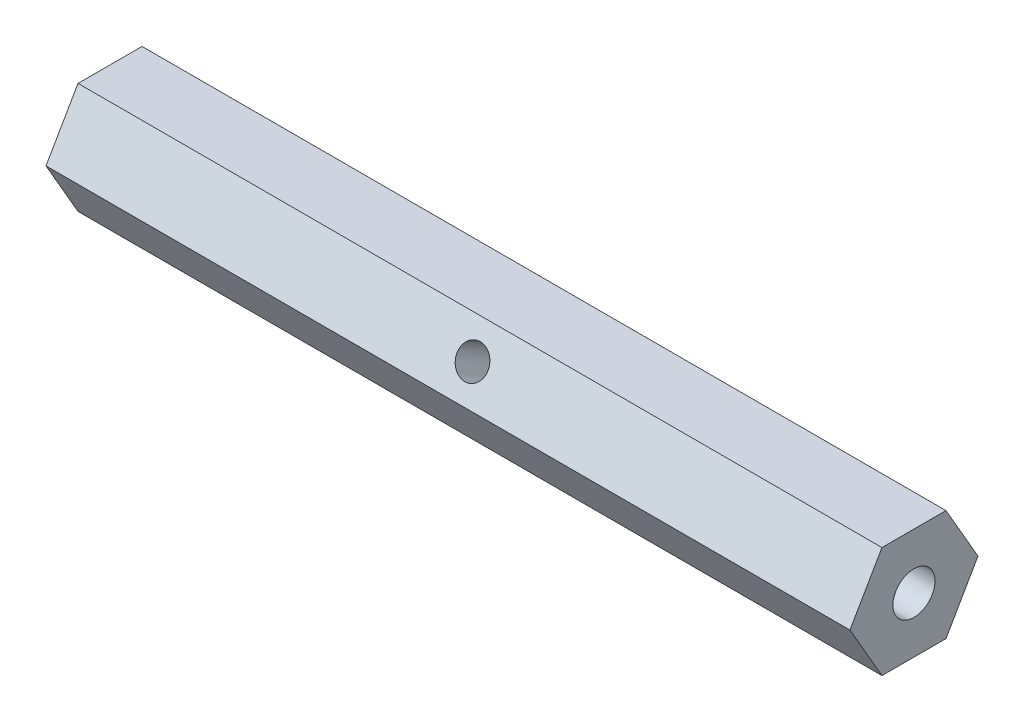
from build123d import *

# Parameters (mm, degrees)
BOSS_EXTRUDE1_DEPTH = 92.075
SKETCH2_R           = 2.413
CUT_EXTRUDE1_DEPTH  = 25.4
SKETCH3_R           = 1.778
CUT_EXTRUDE2_DEPTH  = 25.4


with BuildPart() as part:
    # Sketch1 → Boss-Extrude1 (new body)
    with BuildSketch(Plane(origin=(0, 0, 0), x_dir=(0, 0, -1), z_dir=(1, 0, 0))):
        Polygon((3.666174209, 6.35), (-3.666174209, 6.35), (-7.332348419, 0), (-3.666174209, -6.35), (3.666174209, -6.35), (7.332348419, 0), align=None)
    extrude(amount=BOSS_EXTRUDE1_DEPTH)

    # Sketch2 → Cut-Extrude1 (cut)
    with BuildSketch(Plane(origin=(92.075, 0, 0), x_dir=(0, 0, -1), z_dir=(1, 0, 0))):
        Circle(SKETCH2_R)
    extrude(amount=-CUT_EXTRUDE1_DEPTH, mode=Mode.SUBTRACT)

    # Sketch3 → Cut-Extrude2 (cut)
    with BuildSketch(Plane(origin=(0, 3.175, 5.499261314), x_dir=(1, 0, 0), z_dir=(0, 0.4999999999999995, 0.8660254037844389))):
        with Locations((47.0154, 0)):
            Circle(SKETCH3_R)
    extrude(amount=-CUT_EXTRUDE2_DEPTH, mode=Mode.SUBTRACT)


solid = part.part
